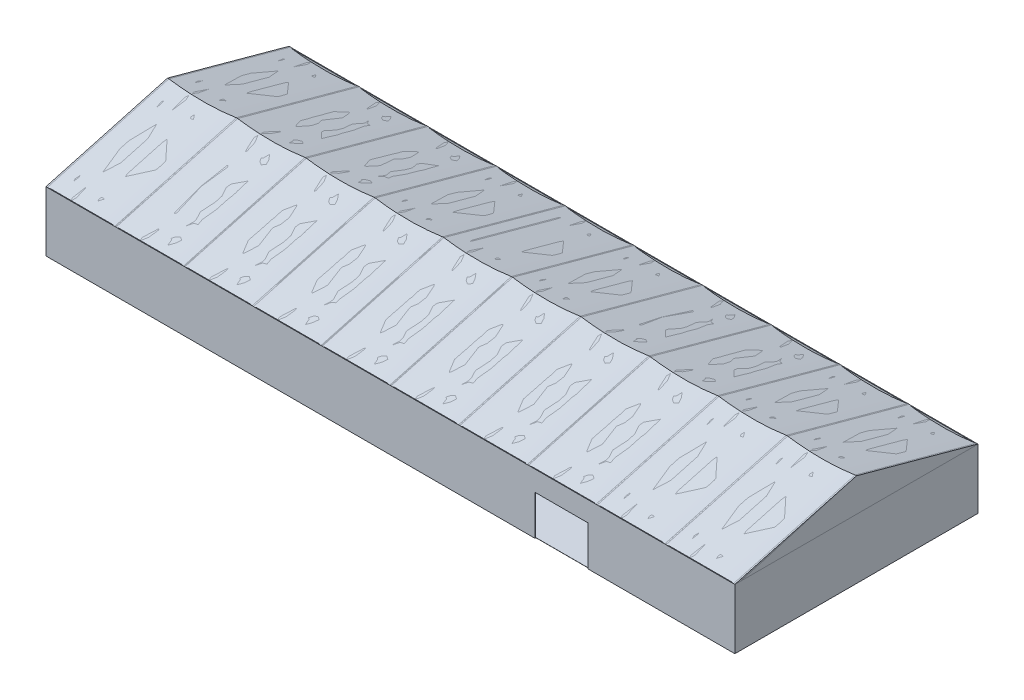
from build123d import *

# Parameters (mm, degrees)
SKETCH1_W                       = 51816
SKETCH1_H                       = 18288
BOSS_EXTRUDE1_DEPTH             = 10
SKETCH2_W                       = 51816
SKETCH2_H                       = 18288
SKETCH2_W_2                     = 51716
SKETCH2_H_2                     = 18188
BOSS_EXTRUDE2_DEPTH             = 4500
SKETCH12_W                      = 100
SKETCH12_H                      = 100
BOSS_EXTRUDE3_DEPTH             = 4500
LPATTERN1_COUNT                 = 11
LPATTERN1_PITCH                 = 5171.6
LPATTERN1_COUNT_DIR2            = 2
LPATTERN1_PITCH_DIR2            = 18188
BOSS_EXTRUDE4_DEPTH             = 100
LPATTERN2_COUNT                 = 11
LPATTERN2_PITCH                 = 5171.6
BOSS_EXTRUDE5_START             = 25808
BOSS_EXTRUDE5_DEPTH             = 100
LPATTERN3_COUNT                 = 10
LPATTERN3_PITCH                 = 5171.6
BOSS_EXTRUDE6_REACH             = 28375.103
SKETCH16_W                      = 100
SKETCH16_H                      = 100
BOSS_EXTRUDE6_DIRECTION_2_REACH = 28375.103
LPATTERN4_COUNT                 = 11
LPATTERN4_PITCH                 = 5171.6
BOSS_EXTRUDE11_DEPTH            = 10
SKETCH21_R                      = 260
SKETCH21_R_2                    = 250
BOSS_EXTRUDE12_DEPTH            = 51816
BOSS_EXTRUDE12_2_DEPTH          = 51816
SKETCH22_W                      = 4000
SKETCH22_H                      = 3000
CUT_EXTRUDE3_DEPTH              = 70
SKETCH23_W                      = 4000
SKETCH23_H                      = 3000
CUT_EXTRUDE4_DEPTH              = 70


# Read off the part's stored shape, not the designer's step: Boss-Extrude5
with BuildPart() as part:
    # Sketch1 → Boss-Extrude1 (new body)
    with BuildSketch(Plane(origin=(0, 0, 0), x_dir=(1, 0, 0), z_dir=(0, 1, 0))):
        Rectangle(SKETCH1_W, SKETCH1_H)
    extrude(amount=BOSS_EXTRUDE1_DEPTH)


with BuildPart() as body_2:
    # Sketch2 → Boss-Extrude2 (new body)
    with BuildSketch(Plane(origin=(0, 10, 0), x_dir=(1, 0, 0), z_dir=(0, 1, 0))):
        Rectangle(SKETCH2_W, SKETCH2_H)
        Rectangle(SKETCH2_W_2, SKETCH2_H_2, mode=Mode.SUBTRACT)
    extrude(amount=BOSS_EXTRUDE2_DEPTH)


with BuildPart() as body_3:
    # Sketch12 → Boss-Extrude3 (new body)
    with BuildSketch(Plane(origin=(0, 4510, 0), x_dir=(1, 0, 0), z_dir=(0, 1, 0))):
        with Locations((25858, 9094)):
            Rectangle(SKETCH12_W, SKETCH12_H)
    boss_extrude3 = extrude(amount=-BOSS_EXTRUDE3_DEPTH)


with BuildPart() as part_1:
    add(part.part)

    add(body_2.part)  # LPattern1 merges body 2
    # LPattern1: Boss-Extrude3 11 × 2
    with Locations(*[(-i * LPATTERN1_PITCH, 0, j * LPATTERN1_PITCH_DIR2) for i in range(LPATTERN1_COUNT) for j in range(LPATTERN1_COUNT_DIR2) if (i, j) != (0, 0)]):
        add(boss_extrude3)

    # Sketch22 → Cut-Extrude3 (cut)
    with BuildSketch(Plane(origin=(0, 0, -9144), x_dir=(-1, 0, 0), z_dir=(0, 0, -1))):
        with Locations((-12872.519467533, 1500)):
            Rectangle(SKETCH22_W, SKETCH22_H)
        with Locations((12872.519467533, 1500)):
            Rectangle(SKETCH22_W, SKETCH22_H)
    extrude(amount=-CUT_EXTRUDE3_DEPTH, mode=Mode.SUBTRACT)

    # Sketch23 → Cut-Extrude4 (cut)
    with BuildSketch(Plane.XY.offset(9144)):
        with Locations((12872.519467533, 1500)):
            Rectangle(SKETCH23_W, SKETCH23_H)
    extrude(amount=-CUT_EXTRUDE4_DEPTH, mode=Mode.SUBTRACT)


with BuildPart() as body_3_2:
    # Sketch13 → Boss-Extrude4 (new body)
    with BuildSketch(Plane(origin=(25908, 0, 0), x_dir=(0, 0, -1), z_dir=(1, 0, 0))):
        Polygon((-9144, 4510), (0, 7010), (9144, 4510), (9117.62756746, 4413.540190743), (6995.889554993, 4993.630417248), (9100.372438842, 3096.803895845), (9096.88068907, 2965.326077765), (6781.492321476, 5052.247333674), (0, 6906.329880009), (-6781.492321476, 5052.247333674), (-9096.88068907, 2965.326077765), (-9100.372438842, 3096.803895845), (-6995.889554993, 4993.630417248), (-9117.62756746, 4413.540190743), align=None)
    extrude(amount=-BOSS_EXTRUDE4_DEPTH)


with BuildPart() as lpattern2_1:
    # LPattern2: pattern copy
    add(body_3_2.part.moved(Location(Vector(-1, 0, 0) * (1 * LPATTERN2_PITCH))))


with BuildPart() as lpattern2_2:
    # LPattern2: pattern copy
    add(body_3_2.part.moved(Location(Vector(-1, 0, 0) * (2 * LPATTERN2_PITCH))))


with BuildPart() as lpattern2_3:
    # LPattern2: pattern copy
    add(body_3_2.part.moved(Location(Vector(-1, 0, 0) * (3 * LPATTERN2_PITCH))))


with BuildPart() as lpattern2_4:
    # LPattern2: pattern copy
    add(body_3_2.part.moved(Location(Vector(-1, 0, 0) * (4 * LPATTERN2_PITCH))))


with BuildPart() as lpattern2_5:
    # LPattern2: pattern copy
    add(body_3_2.part.moved(Location(Vector(-1, 0, 0) * (5 * LPATTERN2_PITCH))))


with BuildPart() as lpattern2_6:
    # LPattern2: pattern copy
    add(body_3_2.part.moved(Location(Vector(-1, 0, 0) * (6 * LPATTERN2_PITCH))))


with BuildPart() as lpattern2_7:
    # LPattern2: pattern copy
    add(body_3_2.part.moved(Location(Vector(-1, 0, 0) * (7 * LPATTERN2_PITCH))))


with BuildPart() as lpattern2_8:
    # LPattern2: pattern copy
    add(body_3_2.part.moved(Location(Vector(-1, 0, 0) * (8 * LPATTERN2_PITCH))))


with BuildPart() as lpattern2_9:
    # LPattern2: pattern copy
    add(body_3_2.part.moved(Location(Vector(-1, 0, 0) * (9 * LPATTERN2_PITCH))))


with BuildPart() as lpattern2_10:
    # LPattern2: pattern copy
    add(body_3_2.part.moved(Location(Vector(-1, 0, 0) * (10 * LPATTERN2_PITCH))))


with BuildPart() as body_14:
    # Boss-Extrude5 outline → Boss-Extrude5 (new body)
    with BuildSketch(Plane.YZ.offset(BOSS_EXTRUDE5_START)):
        Polygon((6906.329880009, 0), (6892.65971378, 50), (4510, 50), (4510, -50), (6892.65971378, -50), align=None)
    extrude(amount=BOSS_EXTRUDE5_DEPTH)


with BuildPart() as body_15:
    # Mirror1: mirrored copy
    add(body_14.part.mirror(Plane(origin=(0, 0, 0), x_dir=(0, 0, 1), z_dir=(1, 0, 0))))


with BuildPart() as body_16:
    # Sweep2: sweep along a curve in space
    with BuildLine() as sweep2_path:
        Line((25808, 4510, -9144), (25808, 7010, 0))
    # Sketch15 → Sweep2 (sweep)
    with BuildSketch(Plane.XY):
        with BuildLine():
            Line((25908, 7010), (25908, 7019.889793912))
            Line((25908, 7019.889793912), (25806.519467533, 7019.889793912))
            add(Edge.make_bspline(
                [(25806.519467533, 7019.889793912), (25780.132264773, 7015.939548766), (25727.326938212, 7008.157932167), (25621.748311005, 6993.093502888), (25489.763367477, 6975.187486671), (25331.385251179, 6955.182857762), (25120.211500331, 6930.485599278), (24856.242442757, 6903.318768843), (24539.47524743, 6876.645929791), (24222.703848531, 6855.900446489), (23800.336014888, 6836.142877232), (23272.364598862, 6826.264116233), (22744.376367596, 6836.142877231), (22321.974903676, 6855.900449156), (22005.168193459, 6876.645936403), (21688.355597526, 6903.318782109), (21424.340301546, 6930.485620419), (21213.124510925, 6955.182887835), (21054.712356899, 6975.187522402), (20922.696902504, 6993.093550747), (20817.092705633, 7008.157975677), (20764.273991922, 7015.939616924), (20737.880164213, 7019.889849033)],
                knots=[0, 0, 0, 0, 0.015625, 0.03125, 0.0625, 0.09375, 0.125, 0.1875, 0.25, 0.3125, 0.375, 0.5, 0.625, 0.6875, 0.75, 0.8125, 0.875, 0.90625, 0.9375, 0.96875, 0.984375, 1, 1, 1, 1], degree=3))
            Line((20737.880164213, 7019.889849033), (20636.4, 7019.889849033))
            Line((20636.4, 7019.889849033), (20636.4, 7010))
            Line((20636.4, 7010), (20736.4, 7010))
            add(Edge.make_bspline(
                [(25808, 7010), (23272.522471629, 6630.431241265), (20736.4, 7010)],
                knots=[0, 0, 0, 1, 1, 1], degree=2))
            Line((25808, 7010), (25908, 7010))
        make_face()
    sweep(path=sweep2_path.line)


with BuildPart() as lpattern3_1:
    # LPattern3: pattern copy
    add(body_16.part.moved(Location(Vector(-1, 0, 0) * (1 * LPATTERN3_PITCH))))


with BuildPart() as lpattern3_2:
    # LPattern3: pattern copy
    add(body_16.part.moved(Location(Vector(-1, 0, 0) * (2 * LPATTERN3_PITCH))))


with BuildPart() as lpattern3_3:
    # LPattern3: pattern copy
    add(body_16.part.moved(Location(Vector(-1, 0, 0) * (3 * LPATTERN3_PITCH))))


with BuildPart() as lpattern3_4:
    # LPattern3: pattern copy
    add(body_16.part.moved(Location(Vector(-1, 0, 0) * (4 * LPATTERN3_PITCH))))


with BuildPart() as lpattern3_5:
    # LPattern3: pattern copy
    add(body_16.part.moved(Location(Vector(-1, 0, 0) * (5 * LPATTERN3_PITCH))))


with BuildPart() as lpattern3_6:
    # LPattern3: pattern copy
    add(body_16.part.moved(Location(Vector(-1, 0, 0) * (6 * LPATTERN3_PITCH))))


with BuildPart() as lpattern3_7:
    # LPattern3: pattern copy
    add(body_16.part.moved(Location(Vector(-1, 0, 0) * (7 * LPATTERN3_PITCH))))


with BuildPart() as lpattern3_8:
    # LPattern3: pattern copy
    add(body_16.part.moved(Location(Vector(-1, 0, 0) * (8 * LPATTERN3_PITCH))))


with BuildPart() as lpattern3_9:
    # LPattern3: pattern copy
    add(body_16.part.moved(Location(Vector(-1, 0, 0) * (9 * LPATTERN3_PITCH))))


with BuildPart() as body_26:
    # Mirror2: mirrored copy
    add(body_16.part.mirror(Plane.XY))


with BuildPart() as body_27:
    # Mirror2 2: mirrored copy
    add(lpattern3_1.part.mirror(Plane.XY))


with BuildPart() as body_28:
    # Mirror2 3: mirrored copy
    add(lpattern3_2.part.mirror(Plane.XY))


with BuildPart() as body_29:
    # Mirror2 4: mirrored copy
    add(lpattern3_3.part.mirror(Plane.XY))


with BuildPart() as body_30:
    # Mirror2 5: mirrored copy
    add(lpattern3_4.part.mirror(Plane.XY))


with BuildPart() as body_31:
    # Mirror2 6: mirrored copy
    add(lpattern3_5.part.mirror(Plane.XY))


with BuildPart() as body_32:
    # Mirror2 7: mirrored copy
    add(lpattern3_6.part.mirror(Plane.XY))


with BuildPart() as body_33:
    # Mirror2 8: mirrored copy
    add(lpattern3_7.part.mirror(Plane.XY))


with BuildPart() as body_34:
    # Mirror2 9: mirrored copy
    add(lpattern3_8.part.mirror(Plane.XY))


with BuildPart() as body_35:
    # Mirror2 10: mirrored copy
    add(lpattern3_9.part.mirror(Plane.XY))


with BuildPart() as body_36:
    # Boss-Extrude6: up to this plane
    boss_extrude6_end = Plane(origin=(25808, 5052.247333674, 6781.492321476), z_dir=(0, -0.9645980925721754, -0.2637243253970344))
    # Sketch16 → Boss-Extrude6 (new, up to the surface)
    with BuildSketch(Plane.XY.offset(50), mode=Mode.PRIVATE) as boss_extrude6_sk1:
        with Locations((25858, 6230.203298054)):
            Rectangle(SKETCH16_W, SKETCH16_H)
    boss_extrude6_tool1 = split(extrude(boss_extrude6_sk1.sketch, amount=BOSS_EXTRUDE6_REACH, mode=Mode.PRIVATE), bisect_by=boss_extrude6_end, keep=Keep.BOTH, mode=Mode.PRIVATE)
    add(boss_extrude6_tool1.solids().sort_by_distance((25858, 6230.203298, 50))[0])

    # Boss-Extrude6 direction 2: up to this plane
    boss_extrude6_direction_2_end = Plane(origin=(25808, 6906.329880009, 0), z_dir=(0, -0.9645980925721765, 0.26372432539703033))
    # Sketch16 → Boss-Extrude6 direction 2 (add, up to the surface)
    with BuildSketch(Plane.XY.offset(50), mode=Mode.PRIVATE) as boss_extrude6_direction_2_sk1:
        with Locations((25858, 6230.203298054)):
            Rectangle(SKETCH16_W, SKETCH16_H)
    boss_extrude6_direction_2_tool1 = split(extrude(boss_extrude6_direction_2_sk1.sketch, amount=-BOSS_EXTRUDE6_DIRECTION_2_REACH, mode=Mode.PRIVATE), bisect_by=boss_extrude6_direction_2_end, keep=Keep.BOTH, mode=Mode.PRIVATE)
    add(boss_extrude6_direction_2_tool1.solids().sort_by_distance((25858, 6230.203298, 50))[0])


with BuildPart() as lpattern4_1:
    # LPattern4: pattern copy
    add(body_36.part.moved(Location(Vector(-1, 0, 0) * (1 * LPATTERN4_PITCH))))


with BuildPart() as lpattern4_2:
    # LPattern4: pattern copy
    add(body_36.part.moved(Location(Vector(-1, 0, 0) * (2 * LPATTERN4_PITCH))))


with BuildPart() as lpattern4_3:
    # LPattern4: pattern copy
    add(body_36.part.moved(Location(Vector(-1, 0, 0) * (3 * LPATTERN4_PITCH))))


with BuildPart() as lpattern4_4:
    # LPattern4: pattern copy
    add(body_36.part.moved(Location(Vector(-1, 0, 0) * (4 * LPATTERN4_PITCH))))


with BuildPart() as lpattern4_5:
    # LPattern4: pattern copy
    add(body_36.part.moved(Location(Vector(-1, 0, 0) * (5 * LPATTERN4_PITCH))))


with BuildPart() as lpattern4_6:
    # LPattern4: pattern copy
    add(body_36.part.moved(Location(Vector(-1, 0, 0) * (6 * LPATTERN4_PITCH))))


with BuildPart() as lpattern4_7:
    # LPattern4: pattern copy
    add(body_36.part.moved(Location(Vector(-1, 0, 0) * (7 * LPATTERN4_PITCH))))


with BuildPart() as lpattern4_8:
    # LPattern4: pattern copy
    add(body_36.part.moved(Location(Vector(-1, 0, 0) * (8 * LPATTERN4_PITCH))))


with BuildPart() as lpattern4_9:
    # LPattern4: pattern copy
    add(body_36.part.moved(Location(Vector(-1, 0, 0) * (9 * LPATTERN4_PITCH))))


with BuildPart() as lpattern4_10:
    # LPattern4: pattern copy
    add(body_36.part.moved(Location(Vector(-1, 0, 0) * (10 * LPATTERN4_PITCH))))


with BuildPart() as body_47:
    # Sketch19 → Boss-Extrude11 (new body)
    with BuildSketch(Plane(origin=(25908, 0, 0), x_dir=(0, 0, -1), z_dir=(1, 0, 0))):
        Polygon((-9144, 4510), (0, 7010), (9144, 4510), align=None)
    extrude(amount=-BOSS_EXTRUDE11_DEPTH)


with BuildPart() as body_48:
    # Mirror3: mirrored copy
    add(body_47.part.mirror(Plane(origin=(0, 0, 0), x_dir=(0, 0, 1), z_dir=(1, 0, 0))))


with BuildPart() as body_49:
    # Sketch21 → Boss-Extrude12 (new, through all)
    with BuildSketch(Plane(origin=(25908, 0, 0), x_dir=(0, 0, -1), z_dir=(1, 0, 0))):
        with Locations(Location((-4503.886539369, 5223.77246613, 0), (0, 0, 90))):
            Circle(SKETCH21_R)
        with Locations(Location((-4503.886539369, 5223.77246613, 0), (0, 0, 90))):
            Circle(SKETCH21_R_2, mode=Mode.SUBTRACT)
    extrude(amount=-BOSS_EXTRUDE12_DEPTH)


with BuildPart() as body_50:
    # Sketch21 → Boss-Extrude12 2 (new, through all)
    with BuildSketch(Plane(origin=(25908, 0, 0), x_dir=(0, 0, -1), z_dir=(1, 0, 0))):
        with Locations(Location((4503.886539369, 5223.77246613, 0), (0, 0, 270))):
            Circle(SKETCH21_R)
        with Locations(Location((4503.886539369, 5223.77246613, 0), (0, 0, 270))):
            Circle(SKETCH21_R_2, mode=Mode.SUBTRACT)
    extrude(amount=-BOSS_EXTRUDE12_2_DEPTH)


solid = Compound([body_3.part, part_1.part, body_3_2.part, lpattern2_1.part, lpattern2_2.part, lpattern2_3.part, lpattern2_4.part, lpattern2_5.part, lpattern2_6.part, lpattern2_7.part, lpattern2_8.part, lpattern2_9.part, lpattern2_10.part, body_14.part, body_15.part, body_16.part, lpattern3_1.part, lpattern3_2.part, lpattern3_3.part, lpattern3_4.part, lpattern3_5.part, lpattern3_6.part, lpattern3_7.part, lpattern3_8.part, lpattern3_9.part, body_26.part, body_27.part, body_28.part, body_29.part, body_30.part, body_31.part, body_32.part, body_33.part, body_34.part, body_35.part, body_36.part, lpattern4_1.part, lpattern4_2.part, lpattern4_3.part, lpattern4_4.part, lpattern4_5.part, lpattern4_6.part, lpattern4_7.part, lpattern4_8.part, lpattern4_9.part, lpattern4_10.part, body_47.part, body_48.part, body_49.part, body_50.part])
